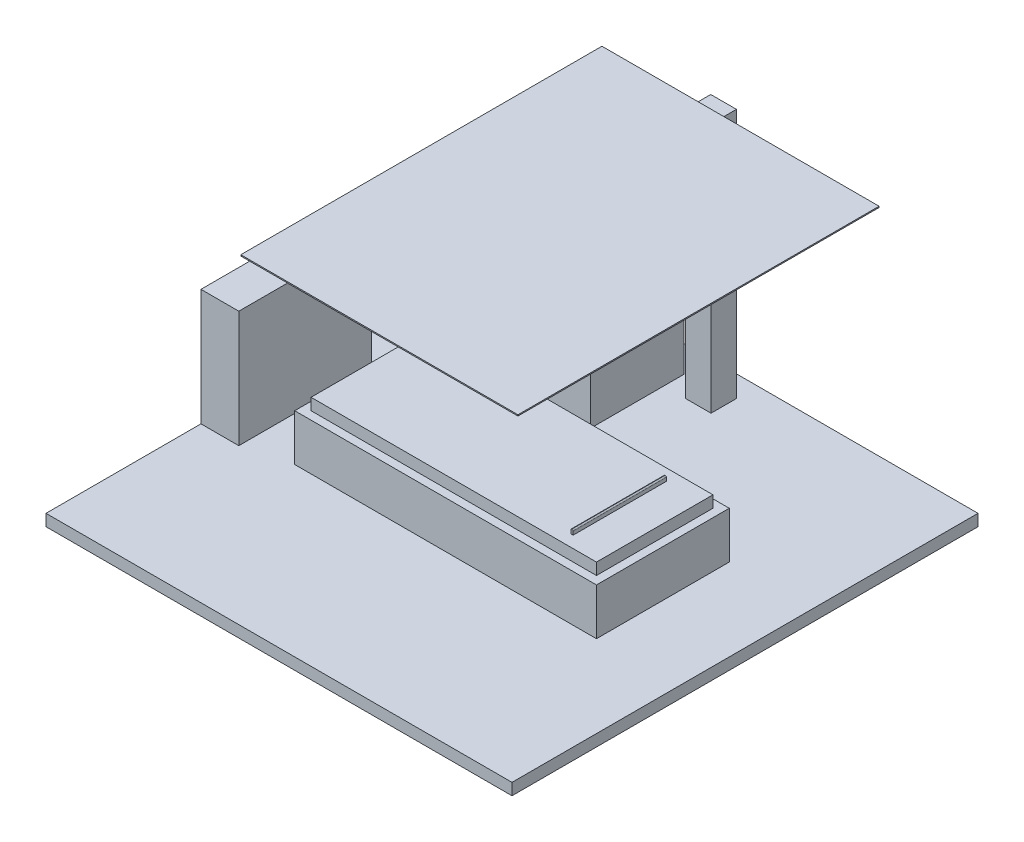
from build123d import *

# Parameters (mm, degrees)
SKETCH1_W                = 4000
SKETCH1_H                = 4000
BOSS_EXTRUDE1_DEPTH      = 100
SKETCH2_W                = 2590
SKETCH2_H                = 1140
BOSS_EXTRUDE2_DEPTH      = 400
SKETCH3_W                = 2450
SKETCH3_H                = 1000
BOSS_EXTRUDE3_DEPTH      = 100
SKETCH4_W                = 1000
SKETCH4_H                = 800
SKETCH4_W_2              = 325
SKETCH4_H_2              = 1140
BOSS_EXTRUDE4_DEPTH      = 1000
SKETCH5_W                = 220.553052424
SKETCH5_H                = 218.102085328
BOSS_EXTRUDE5_DEPTH      = 2150
BOSS_EXTRUDE6_DEPTH      = 3000
BOSS_EXTRUDE6_DEPTH_BACK = 100
SKETCH6_W                = 2378.927803787
SKETCH6_H                = 10
SKETCH7_W                = 20
SKETCH7_H                = 800
BOSS_EXTRUDE7_DEPTH      = 40
FILLET1_R                = 10


with BuildPart() as part:
    # Sketch1 → Boss-Extrude1 (new body)
    with BuildSketch(Plane(origin=(0, 0, 0), x_dir=(1, 0, 0), z_dir=(0, 1, 0))):
        Rectangle(SKETCH1_W, SKETCH1_H)
    extrude(amount=BOSS_EXTRUDE1_DEPTH)

    # Sketch2 → Boss-Extrude2 (add)
    with BuildSketch(Plane(origin=(0, 100, 0), x_dir=(1, 0, 0), z_dir=(0, 1, 0))):
        Rectangle(SKETCH2_W, SKETCH2_H)
    extrude(amount=BOSS_EXTRUDE2_DEPTH)

    # Sketch3 → Boss-Extrude3 (add)
    with BuildSketch(Plane(origin=(0, 500, 0), x_dir=(1, 0, 0), z_dir=(0, 1, 0))):
        Rectangle(SKETCH3_W, SKETCH3_H)
    extrude(amount=BOSS_EXTRUDE3_DEPTH)

    # Sketch4 → Boss-Extrude4 (add)
    with BuildSketch(Plane(origin=(0, 100, 0), x_dir=(1, 0, 0), z_dir=(0, 1, 0))):
        with Locations((-795, 1370)):
            Rectangle(SKETCH4_W, SKETCH4_H)
        with Locations((-1837.5, -100)):
            Rectangle(SKETCH4_W_2, SKETCH4_H_2)
    extrude(amount=BOSS_EXTRUDE4_DEPTH)

    # Sketch5 → Boss-Extrude5 (add)
    with BuildSketch(Plane(origin=(0, 100, 0), x_dir=(1, 0, 0), z_dir=(0, 1, 0))):
        with Locations((0, 1707.273154618)):
            Rectangle(SKETCH5_W, SKETCH5_H)
    extrude(amount=BOSS_EXTRUDE5_DEPTH)

    # Sketch6 → Boss-Extrude6 (add, two sides: drawn at the far end of the back side and taken through both)
    with BuildSketch(Plane.XY.offset(-1598.222111954).offset(-BOSS_EXTRUDE6_DEPTH_BACK)):
        with Locations((263.274031351, 2255)):
            Rectangle(SKETCH6_W, SKETCH6_H)
    extrude(amount=BOSS_EXTRUDE6_DEPTH + BOSS_EXTRUDE6_DEPTH_BACK)

    # Sketch7 → Boss-Extrude7 (add)
    with BuildSketch(Plane(origin=(0, 600, 0), x_dir=(1, 0, 0), z_dir=(0, 1, 0))):
        with Locations((915, 0)):
            Rectangle(SKETCH7_W, SKETCH7_H)
    extrude(amount=BOSS_EXTRUDE7_DEPTH)

    # Fillet1
    fillet1_edges = [part.edges().sort_by_distance(p)[0] for p in [
        (925, 640, 0),
        (905, 640, 0),
    ]]
    fillet(fillet1_edges, radius=FILLET1_R - 0.0001)  # a hair under: the kernel refuses the full size


solid = part.part
